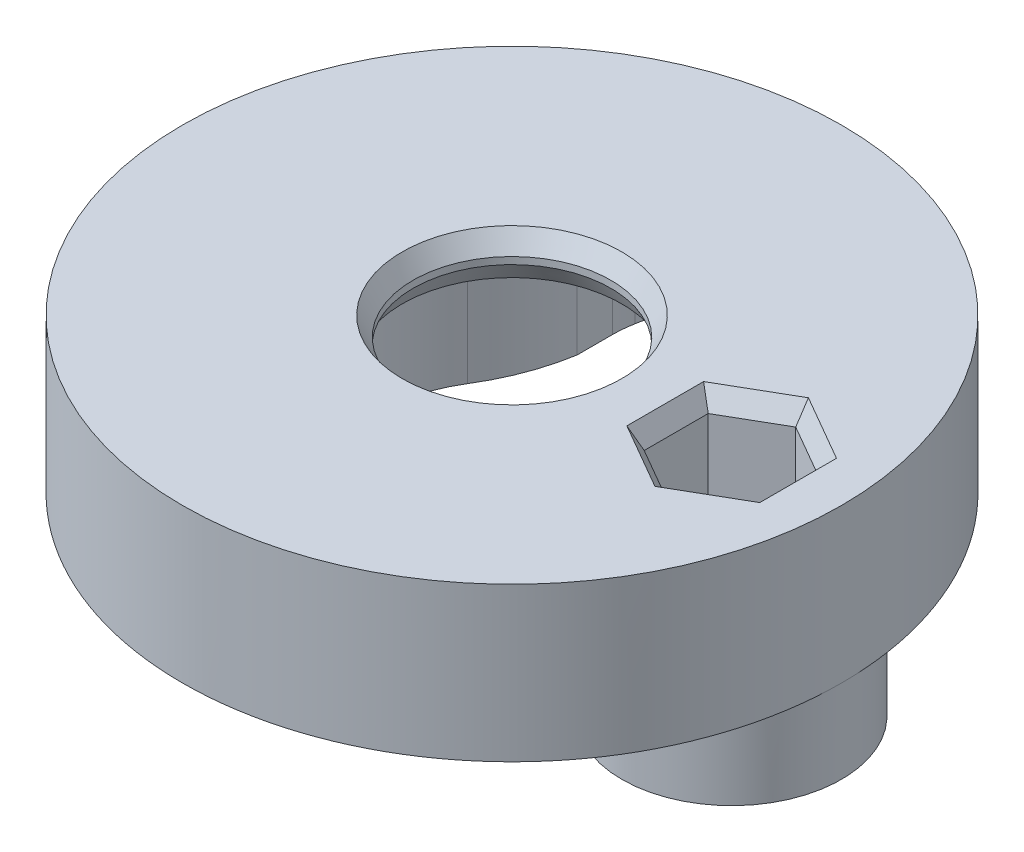
from build123d import *
from OCP.BRepFilletAPI import BRepFilletAPI_MakeChamfer

# Parameters (mm, degrees)
SKETCH_1_R          = 15
EXTRUDE_1_DEPTH     = 10.8
SKETCH_2_R          = 2
SKETCH_2_R_2        = 1.6500000000000006
CUT_EXTRUDE_1_DEPTH = 24.804201309852846
CUT_EXTRUDE_START   = -8.75
CUT_EXTRUDE_2_DEPTH = 8.75
SKETCH_8_R          = 4.5
CUT_EXTRUDE_3_DEPTH = 23.946949687399407
CUT_EXTRUDE_4_DEPTH = 5.3
SKETCH_10_R         = 20.165884728601043
SKETCH_10_R_2       = 4.999999999999998
CUT_EXTRUDE_5_DEPTH = 3.8
CHAMFER_1_SIZE      = 0.5
CHAMFER_1_SIZE2     = 0.8660254037844434
CHAMFER_1_SIZE2_2   = 0.866025403784443
CHAMFER_2_SIZE      = 0.5
CHAMFER_2_SIZE2     = 0.8660254037844434
CHAMFER_5_SIZE      = 3
CUT_EXTRUDE_8_DEPTH = 4.949999997
FILLET_1_R          = 10
EXTRUDE_3_DEPTH     = 4.949999997
FILLET_2_R          = 6


with BuildPart() as part:
    # 草图1 → 凸台-拉伸1 (new body)
    with BuildSketch(Plane(origin=(0, 0, 0), x_dir=(1, 0, 0), z_dir=(0, 1, 0))):
        with Locations(Location((0, 0, 0), (0, 0, 90))):
            Circle(SKETCH_1_R)
    extrude(amount=EXTRUDE_1_DEPTH)

    # 草图2 → 切除-拉伸1 (cut, through all)
    with BuildSketch(Plane(origin=(0, 10.8, 0), x_dir=(1, 0, 0), z_dir=(0, 1, 0))):
        with Locations(Location((0, 0, 0), (0, 0, 270))):
            Circle(SKETCH_2_R)
        with Locations(Location((10, 0, 0), (0, 0, 270))):
            Circle(SKETCH_2_R_2)
    extrude(amount=-CUT_EXTRUDE_1_DEPTH, mode=Mode.SUBTRACT)

    # 草图7 → 切除-拉伸2 (cut)
    with BuildSketch(Plane.XZ.offset(CUT_EXTRUDE_START)):
        with BuildLine():
            Line((3.9499999999999917, -8.530207271324839), (3.9499999999999926, -5.297169055259961))
            ThreePointArc((3.9499999999999926, -5.297169055259961), (4.032732694169919, -4.898896925108727), (4.267241379310367, -4.566525047637877))
            ThreePointArc((4.267241379310367, -4.566525047637877), (6.250000000000189, 1.0156e-13), (4.2672413793103745, 4.5665250476380885))
            ThreePointArc((4.2672413793103745, 4.5665250476380885), (4.03273269416984, 4.898896925108895), (3.9500000000000046, 5.297169055260161))
            Line((3.9500000000000046, 5.297169055260161), (3.9500000000000046, 8.530207271324992))
            ThreePointArc((3.9500000000000046, 8.530207271324992), (3.9280745447413654, 8.997939916110184), (3.8624904692009197, 9.461570460424896))
            Line((3.8624904692009197, 9.461570460424896), (2.357995425216292, 17.39705433076952))
            ThreePointArc((2.357995425216292, 17.39705433076952), (-3.9497e-13, 19.350000000001156), (-2.357995425216957, 17.397054330769397))
            Line((-2.357995425216957, 17.397054330769397), (-3.8624904692015747, 9.461570460424964))
            ThreePointArc((-3.8624904692015747, 9.461570460424964), (-3.9280745447421004, 8.997939916110258), (-3.950000000000667, 8.530207271325056))
            Line((-3.950000000000667, 8.530207271325056), (-3.9500000000006588, 5.297169055260163))
            ThreePointArc((-3.9500000000006588, 5.297169055260163), (-4.0327326941706, 4.898896925108942), (-4.267241379311038, 4.5665250476381))
            ThreePointArc((-4.267241379311038, 4.5665250476381), (-6.250000000000874, 1.1135e-13), (-4.267241379311047, -4.566525047637879))
            ThreePointArc((-4.267241379311047, -4.566525047637879), (-4.032732694170509, -4.898896925108689), (-3.9500000000006716, -5.29716905525996))
            Line((-3.9500000000006716, -5.29716905525996), (-3.950000000000676, -8.530207271324784))
            ThreePointArc((-3.950000000000676, -8.530207271324784), (-3.9280745447420373, -8.997939916109978), (-3.862490469201592, -9.461570460424696))
            Line((-3.862490469201592, -9.461570460424696), (-2.3579954252169664, -17.397054330769286))
            ThreePointArc((-2.3579954252169664, -17.397054330769286), (-2.7734e-13, -19.35000000000094), (2.3579954252163073, -17.39705433076917))
            Line((2.3579954252163073, -17.39705433076917), (3.8624904692009046, -9.461570460424774))
            ThreePointArc((3.8624904692009046, -9.461570460424774), (3.9280745447414347, -8.997939916110052), (3.9499999999999917, -8.530207271324839))
        make_face()
    extrude(amount=CUT_EXTRUDE_2_DEPTH, mode=Mode.SUBTRACT)

    # 草图8 → 切除-拉伸3 (cut, through all)
    with BuildSketch(Plane.XZ.offset(-8.749999997487969)):
        with Locations(Location((0, 0, 0), (0, 0, 270))):
            Circle(SKETCH_8_R)
    extrude(amount=-CUT_EXTRUDE_3_DEPTH, mode=Mode.SUBTRACT)

    # 草图9 → 切除-拉伸4 (cut)
    with BuildSketch(Plane(origin=(0, 10.8, 0), x_dir=(1, 0, 0), z_dir=(0, 1, 0))):
        Polygon((10.000000000000002, -2.9156188594076102), (12.525000000000002, -1.4578094297038038), (12.525000000000002, 1.457809429703804), (10.000000000000002, 2.915618859407609), (7.475000000000001, 1.4578094297038038), (7.475000000000001, -1.457809429703805), align=None)
    extrude(amount=-CUT_EXTRUDE_4_DEPTH, mode=Mode.SUBTRACT)

    # 草图10 → 切除-拉伸5 (cut)
    with BuildSketch(Plane.XZ):
        Circle(SKETCH_10_R)
        with Locations((10, 0)):
            Circle(SKETCH_10_R_2, mode=Mode.SUBTRACT)
    extrude(amount=-CUT_EXTRUDE_5_DEPTH, mode=Mode.SUBTRACT)

    # 倒角1: one chamfer whose edges measure the first distance from different faces: ONE call of the kernel's chamfer builder (chamfer() names one face for all edges)
    chamfer_1_edges_1 = [part.edges().sort_by_distance(p)[0] for p in [
        (1.63e-14, 8.749999997487969, 4.5),
    ]]
    chamfer_1_side_1 = [part.faces().sort_by_distance(p)[0] for p in [
        (-5.92500000000087, 8.75, 1.129e-13),
    ]]
    chamfer_1_edges_2 = [part.edges().sort_by_distance(p)[0] for p in [
        (1.629e-14, 10.8, 4.5),
    ]]
    chamfer_1_side_2 = [part.faces().sort_by_distance(p)[0] for p in [
        (-9.15e-15, 10.8, 14.575735931288072),
    ]]
    chamfer_1_edges_3 = [part.edges().sort_by_distance(p)[0] for p in [
        (10, 5.500000000000001, -1.6500000000000006),
    ]]
    chamfer_1_side_3 = [part.faces().sort_by_distance(p)[0] for p in [
        (11.22392998790079, 5.500000000000001, 2.1199089239513262),
    ]]
    chamfer_1_edges_4 = [part.edges().sort_by_distance(p)[0] for p in [
        (10, 0, -1.6500000000000006),
    ]]
    chamfer_1_side_4 = [part.faces().sort_by_distance(p)[0] for p in [
        (14.863459938199213, 0, -5.27e-14),
    ]]
    chamfer_1 = BRepFilletAPI_MakeChamfer(part.part.solid().wrapped)
    for e in chamfer_1_edges_1:
        chamfer_1.Add(CHAMFER_1_SIZE, CHAMFER_1_SIZE2, e.wrapped, chamfer_1_side_1[0].wrapped)  # the first distance lies on this face
    for e in chamfer_1_edges_2:
        chamfer_1.Add(CHAMFER_1_SIZE, CHAMFER_1_SIZE2_2, e.wrapped, chamfer_1_side_2[0].wrapped)  # the first distance lies on this face
    for e in chamfer_1_edges_3:
        chamfer_1.Add(CHAMFER_1_SIZE, CHAMFER_1_SIZE2, e.wrapped, chamfer_1_side_3[0].wrapped)  # the first distance lies on this face
    for e in chamfer_1_edges_4:
        chamfer_1.Add(CHAMFER_1_SIZE, CHAMFER_1_SIZE2, e.wrapped, chamfer_1_side_4[0].wrapped)  # the first distance lies on this face
    add(Compound.cast(chamfer_1.Shape()), mode=Mode.REPLACE)

    # 倒角2
    chamfer_2_edges = [part.edges().sort_by_distance(p)[0] for p in [
        (8.7375, 10.8, 2.1867141445557077),
        (11.262500000000003, 10.8, 2.1867141445557072),
        (12.525000000000002, 10.8, 0),
        (11.262500000000003, 10.8, -2.1867141445557063),
        (8.7375, 10.8, -2.1867141445557063),
        (7.475000000000001, 10.8, 4.4e-16),
    ]]
    chamfer_2_side = [part.faces().sort_by_distance(p)[0] for p in [
        (1.659e-14, 10.8, 5.424264068711929),
    ]]
    chamfer(chamfer_2_edges, length=CHAMFER_2_SIZE, length2=CHAMFER_2_SIZE2, reference=chamfer_2_side[0])

    # 倒角5
    # the kernel refuses this chamfer: 3, 1.026536878 mm, written as the material it takes off along each edge
    with BuildSketch(Plane(origin=(2.8648031094259725, 8.75, -14.723888859408826), x_dir=(0.9744700322963631, 0, 0.22451760767548937), z_dir=(0, -1, 0))) as chamfer_5_piece_1:
        with BuildLine():
            Line((1.0282150476584273, 1e-17), (CHAMFER_5_SIZE * 0.402105224967, CHAMFER_5_SIZE * 0.915593462217))
            Line((CHAMFER_5_SIZE * 0.402105224967, CHAMFER_5_SIZE * 0.915593462217), (0, 0))
            ThreePointArc((0, 0), (0.5102384602977388, -0.00881230806576972), (1.0282150476584273, 1e-17))
        make_face()
    extrude(amount=12.732584197651619, mode=Mode.SUBTRACT)
    with BuildSketch(Plane(origin=(-2.864803109426696, 8.75, 14.723888859408683), x_dir=(-0.974470032296352, 0, -0.22451760767553783), z_dir=(0, -1, 0))) as chamfer_5_piece_2:
        with BuildLine():
            Line((1.028215047658435, -1e-17), (CHAMFER_5_SIZE * 0.402105224967, CHAMFER_5_SIZE * 0.915593462217))
            Line((CHAMFER_5_SIZE * 0.402105224967, CHAMFER_5_SIZE * 0.915593462217), (0, 0))
            ThreePointArc((0, 0), (0.5102384602977391, -0.00881230806576976), (1.028215047658435, -1e-17))
        make_face()
    extrude(amount=12.732584197651615, mode=Mode.SUBTRACT)
    with BuildSketch(Plane(origin=(2.86480310942602, 8.75, 14.723888859408815), x_dir=(0.9744700322963621, 0, -0.22451760767549345), z_dir=(0, -1, 0))) as chamfer_5_piece_3:
        with BuildLine():
            Line((1.0282150476584324, 0), (CHAMFER_5_SIZE * 0.402105224967, -CHAMFER_5_SIZE * 0.915593462217))
            Line((CHAMFER_5_SIZE * 0.402105224967, -CHAMFER_5_SIZE * 0.915593462217), (0, 0))
            ThreePointArc((0, 0), (0.510238460297736, 0.00881230806577126), (1.0282150476584324, 0))
        make_face()
    extrude(amount=12.73258419765161, mode=Mode.SUBTRACT)
    with BuildSketch(Plane(origin=(-2.864803109426677, 8.75, -14.723888859408687), x_dir=(-0.9744700322963524, 0, 0.22451760767553572), z_dir=(0, -1, 0))) as chamfer_5_piece_4:
        with BuildLine():
            Line((1.0282150476584369, 1e-17), (CHAMFER_5_SIZE * 0.402105224967, -CHAMFER_5_SIZE * 0.915593462217))
            Line((CHAMFER_5_SIZE * 0.402105224967, -CHAMFER_5_SIZE * 0.915593462217), (0, 0))
            ThreePointArc((0, 0), (0.5102384602977413, 0.00881230806576916), (1.0282150476584369, 1e-17))
        make_face()
    extrude(amount=12.73258419765161, mode=Mode.SUBTRACT)

    # 草图15 → 切除-拉伸8 (cut)
    with BuildSketch(Plane.XZ.offset(-8.749999997487969)):
        Polygon((-3.9500000000006734, 6.9136881632925755), (-4.267241379311041, 4.566525047638101), (4.2672413793103265, 4.566525047638054), (3.94999999999999, 6.913688163292576), align=None)
        Polygon((3.9499999999999864, -6.913688163292576), (-3.95000000000067, -6.9136881632925755), (-4.267241379311037, -4.566525047638101), (4.267241379310323, -4.566525047638054), align=None)
    extrude(amount=CUT_EXTRUDE_8_DEPTH, mode=Mode.SUBTRACT)

    # 圆角1
    # the kernel refuses this fillet: 10 mm, written as the material it takes off along each edge
    with BuildSketch(Plane(origin=(-4.267241379311048, 8.75, -4.566525047637879), x_dir=(0.1339416025290595, 0, -0.9909892265367709), z_dir=(0, -1, 0))) as fillet_1_piece_1:
        with BuildLine():
            CenterArc((2.6767916675051966, -9.995246842433291), FILLET_1_R, 91.76663137711618, 22.314975038449404)
            ThreePointArc((-1.403582267080249, -0.865594682906308), (-0.6731180144781167, -0.47929148270895244), (0, 0))
            Line((0, 0), (2.3685051792716596, 0))
        make_face()
    extrude(amount=10.87126294817915, mode=Mode.SUBTRACT)
    with BuildSketch(Plane(origin=(4.2672413793103665, 8.75, -4.566525047637878), x_dir=(0.6341871066199304, 0, 0.7731796128953744), z_dir=(0, -1, 0))) as fillet_1_piece_2:
        with BuildLine():
            CenterArc((2.968252578056993, -9.912600552088037), FILLET_1_R, 97.58069095736383, 22.314975038449475)
            Line((-2.0159690616089736, -1.2432560182328116), (0, 0))
            ThreePointArc((0, 0), (0.8245146050158637, -0.05462465494498077), (1.6490292100317274, 2e-17))
        make_face()
    extrude(amount=10.871262948179146, mode=Mode.SUBTRACT)
    with BuildSketch(Plane(origin=(4.267241379310374, 8.75, 4.566525047638088), x_dir=(-0.13394160252906265, 0, 0.9909892265367705), z_dir=(0, -1, 0))) as fillet_1_piece_3:
        with BuildLine():
            CenterArc((2.676791667505193, -9.995246842433284), FILLET_1_R, 91.76663137711736, 22.314975038448097)
            ThreePointArc((-1.4035822670802323, -0.8655946829062929), (-0.673118014478111, -0.4792914827089432), (0, 0))
            Line((0, 0), (2.3685051792714518, -2e-17))
        make_face()
    extrude(amount=10.87126294817863, mode=Mode.SUBTRACT)
    with BuildSketch(Plane(origin=(-4.267241379311038, 8.75, 4.5665250476381), x_dir=(-0.6341871066199348, 0, -0.7731796128953706), z_dir=(0, -1, 0))) as fillet_1_piece_4:
        with BuildLine():
            CenterArc((2.9682525780569233, -9.91260055208804), FILLET_1_R, 97.58069095736364, 22.314975038448054)
            Line((-2.0159690616087995, -1.243256018232675), (0, 0))
            ThreePointArc((0, 0), (0.8245146050158442, -0.05462465494498064), (1.6490292100316903, 3e-17))
        make_face()
    extrude(amount=10.871262948178595, mode=Mode.SUBTRACT)

    # 凸台-拉伸3: read off the stored shape, not the designer's step
    # 凸台-拉伸3 outline → 凸台-拉伸3 (add)
    with BuildSketch(Plane.XZ.offset(-8.749999997487969)):
        with BuildLine():
            Line((-3.423621023, 11.776394578), (0, 13.273669394))
            Line((0, 13.273669394), (3.423621023, 11.776394578))
            Line((3.423621023, 11.776394578), (3.86676786, 14.493036477))
            ThreePointArc((3.86676786, 14.493036477), (0, 15), (-3.86676786, 14.493036477))
            Line((-3.86676786, 14.493036477), (-3.423621023, 11.776394578))
        make_face()
        with BuildLine():
            Line((-3.423621023, -11.776394578), (-3.86676786, -14.493036477))
            ThreePointArc((-3.86676786, -14.493036477), (0, -15), (3.86676786, -14.493036477))
            Line((3.86676786, -14.493036477), (3.423621023, -11.776394578))
            Line((3.423621023, -11.776394578), (0, -13.273669394))
            Line((0, -13.273669394), (-3.423621023, -11.776394578))
        make_face()
    extrude(amount=EXTRUDE_3_DEPTH)

    # 圆角2
    fillet_2_edges = [part.edges().sort_by_distance(p)[0] for p in [
        (1.07e-14, 6.274999998987969, 13.273669394),
        (1.07e-14, 6.274999998987969, -13.273669394),
    ]]
    fillet(fillet_2_edges, radius=FILLET_2_R)


solid = part.part
